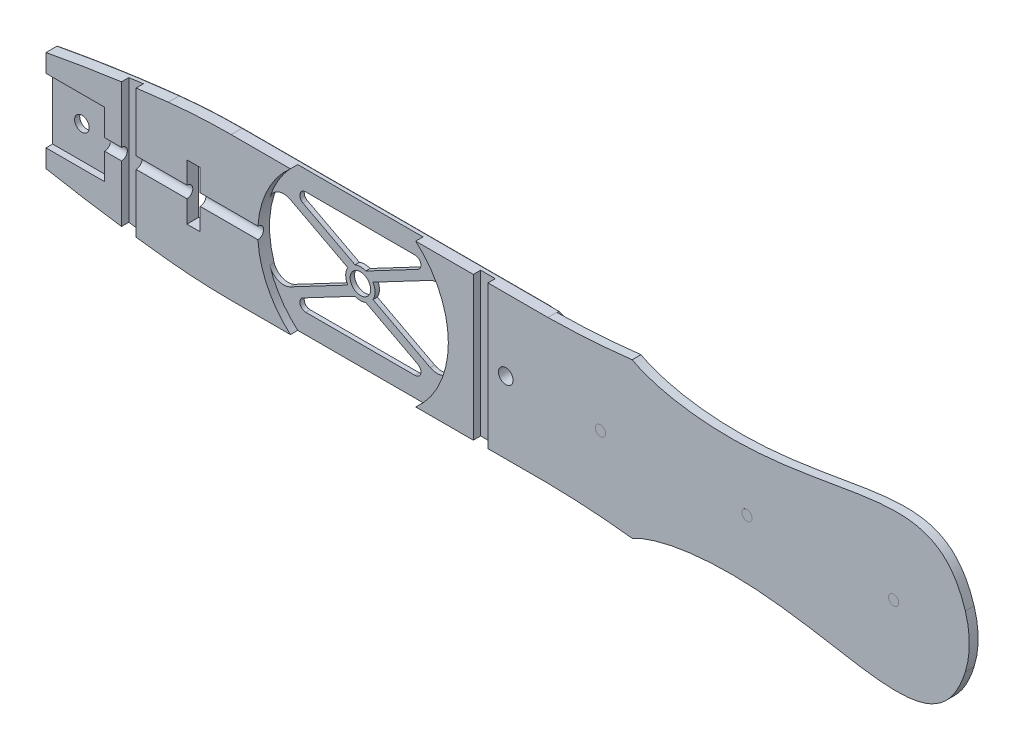
from build123d import *
from build123d.topology import SkipClean

# Parameters (mm, degrees)
BOSS_EXTRUDE1_DEPTH      = 8
FILLET2_R                = 2
SKETCH3_R                = 2.5
CUT_EXTRUDE1_DEPTH       = 8
SKETCH4_R                = 3.5
CUT_EXTRUDE2_DEPTH       = 8
CUT_EXTRUDE3_DEPTH       = 2.5
CUT_EXTRUDE3_DEPTH_BACK  = 2.5
SKETCH5_R                = 32.5
SKETCH6_W                = 4.5
SKETCH6_H                = 19
CUT_EXTRUDE4_DEPTH       = 10
SKETCH7_W                = 5
SKETCH7_H                = 5
CUT_EXTRUDE5_DEPTH       = 51
FILLET3_START            = -1
FILLET3_DEPTH            = 10
FILLET4_START            = -1
FILLET4_DEPTH            = 10
SKETCH9_W                = 5
SKETCH9_H                = 5
CUT_EXTRUDE6_DEPTH       = 51
CUT_EXTRUDE7_DEPTH       = 64
CUT_EXTRUDE7_DEPTH_BACK  = 25
SKETCH10_R               = 2
FILLET5_DEPTH            = 1.5
FILLET5_START            = 6.5
FILLET5_2_DEPTH          = 1.5
CUT_EXTRUDE8_START       = -4
CUT_EXTRUDE8_DEPTH       = 4
FILLET6_R                = 0.3
SKETCH13_W               = 4.5
SKETCH13_H               = 22
CUT_EXTRUDE9_DEPTH       = 20
SKETCH14_R               = 2.5
CUT_EXTRUDE10_DEPTH      = 10
BOSS_EXTRUDE2_DEPTH      = 3
FILLET7_R                = 5
BOSS_EXTRUDE3_DEPTH      = 3
FILLET8_R                = 30
SKETCH17_R               = 1.75
CUT_EXTRUDE11_DEPTH      = 3
BOSS_EXTRUDE4_DEPTH      = 10
BOSS_EXTRUDE4_DEPTH_BACK = 3
SKETCH18_R               = 1.75
BOSS_EXTRUDE5_DEPTH      = 10
BOSS_EXTRUDE5_DEPTH_BACK = 3
SKETCH19_R               = 1.75
BOSS_EXTRUDE6_DEPTH      = 9.5
BOSS_EXTRUDE6_DEPTH_BACK = 3
SKETCH20_R               = 1.75


with BuildPart() as part:
    # Sketch2 → Boss-Extrude1 (new body)
    with BuildSketch(Plane.XY):
        with BuildLine():
            Line((-102.95960155, 17.159933592), (-102.95960155, -17.159933592))
            add(Edge.make_bspline(
                [(-102.95960155, -17.159933592), (-76.189992309, -22.210205625), (-49.286425804, -24.488951052)],
                knots=[0, 0, 0, 0.320704871, 0.320704871, 0.320704871], degree=2))
            Line((-49.286425804, -24.488951052), (65.285160882, -24.488951052))
            Line((65.285160882, -24.488951052), (65.285160882, 24.488951052))
            Line((65.285160882, 24.488951052), (-49.286425804, 24.488951052))
            add(Edge.make_bspline(
                [(-102.95960155, 17.159933592), (-76.189992309, 22.210205625), (-49.286425804, 24.488951052)],
                knots=[0, 0, 0, 0.320704871, 0.320704871, 0.320704871], degree=2))
        make_face()
        with BuildLine():
            Line((-24.971677166, 17.771677006), (28.500163837, 17.771677006))
            Line((28.500163837, 17.771677006), (3.599814154, 4.650879462))
            ThreePointArc((3.599814154, 4.650879462), (1.764243335, 5), (-0.071327484, 4.650879462))
            Line((-0.071327484, 4.650879462), (-24.971677166, 17.771677006))
        make_face(mode=Mode.SUBTRACT)
        with BuildLine():
            Line((3.599814154, -4.650879462), (28.500163837, -17.771677006))
            Line((28.500163837, -17.771677006), (-24.971677166, -17.771677006))
            Line((-24.971677166, -17.771677006), (-0.071327484, -4.650879462))
            ThreePointArc((-0.071327484, -4.650879462), (1.764243335, -5), (3.599814154, -4.650879462))
        make_face(mode=Mode.SUBTRACT)
        with BuildLine():
            Line((-2.525196045, 2.569184657), (-26.859859934, 15.391904107))
            ThreePointArc((-26.859859934, 15.391904107), (-30.735756665, 0), (-26.859859934, -15.391904107))
            Line((-26.859859934, -15.391904107), (-2.525196045, -2.569184657))
            ThreePointArc((-2.525196045, -2.569184657), (-3.235756665, 0), (-2.525196045, 2.569184657))
        make_face(mode=Mode.SUBTRACT)
        with BuildLine():
            Line((6.053682716, -2.569184657), (30.388346604, -15.391904107))
            ThreePointArc((30.388346604, -15.391904107), (34.264243335, 0), (30.388346604, 15.391904107))
            Line((30.388346604, 15.391904107), (6.053682716, 2.569184657))
            ThreePointArc((6.053682716, 2.569184657), (6.764243335, 0), (6.053682716, -2.569184657))
        make_face(mode=Mode.SUBTRACT)
    extrude(amount=BOSS_EXTRUDE1_DEPTH)

    # Fillet2
    fillet2_edges = [part.edges().sort_by_distance(p)[0] for p in [
        (-24.971677166, 17.771677006, 4),
        (28.500163837, 17.771677006, 4),
        (-24.971677166, -17.771677006, 4),
        (28.500163837, -17.771677006, 4),
    ]]
    fillet(fillet2_edges, radius=FILLET2_R)

    # Sketch3 → Cut-Extrude1 (cut)
    with BuildSketch(Plane.XY.offset(8)):
        with Locations((53.859940094, 0)):
            Circle(SKETCH3_R)
    extrude(amount=-CUT_EXTRUDE1_DEPTH, mode=Mode.SUBTRACT)

    # Sketch4 → Cut-Extrude2 (cut)
    with BuildSketch(Plane.XY.offset(8)):
        with Locations((1.764243335, 0)):
            Circle(SKETCH4_R)
    extrude(amount=-CUT_EXTRUDE2_DEPTH, mode=Mode.SUBTRACT)

    # Sketch5 → Cut-Extrude3 (cut, two sides: drawn at the far end of the back side and taken through both)
    with SkipClean():  # the faces are left unmerged after this step: merging them gives an invalid solid
        with BuildSketch(Plane.XY.offset(4).offset(-CUT_EXTRUDE3_DEPTH_BACK)):
            with Locations((1.764243335, 0)):
                Circle(SKETCH5_R)
        extrude(amount=CUT_EXTRUDE3_DEPTH + CUT_EXTRUDE3_DEPTH_BACK, mode=Mode.SUBTRACT)

    # Sketch6 → Cut-Extrude4 (cut)
    with SkipClean():  # the faces are left unmerged after this step: merging them gives an invalid solid
        with BuildSketch(Plane.XY.offset(8)):
            with Locations((-52.644112073, 0)):
                Rectangle(SKETCH6_W, SKETCH6_H)
        extrude(amount=-CUT_EXTRUDE4_DEPTH, mode=Mode.SUBTRACT)

    # Sketch7 → Cut-Extrude5 (cut)
    with SkipClean():  # the faces are left unmerged after this step: merging them gives an invalid solid
        with BuildSketch(Plane(origin=(0, 24.488951052, 0), x_dir=(1, 0, 0), z_dir=(0, 1, 0))):
            with Locations((45.285160882, -4)):
                Rectangle(SKETCH7_W, SKETCH7_H)
        extrude(amount=-CUT_EXTRUDE5_DEPTH, mode=Mode.SUBTRACT)

    # Fillet3: read off the stored shape, not the designer's step
    # Fillet3 outline → Fillet3 (cut)
    with SkipClean():  # the faces are left unmerged after this step: merging them gives an invalid solid
        with BuildSketch(Plane.XY.offset(FILLET3_START)):
            with BuildLine():
                add(Edge.make_bspline(
                    [(-49.286425804, 24.488951052), (-55.269151656, 23.982211205), (-61.245253134, 23.338415518)],
                    knots=[0, 0, 0, 0.071317285, 0.071317285, 0.071317285], degree=2))
                ThreePointArc((-61.245253134, 23.338415518), (-50.549825889, 24.201110037), (-39.823523948, 24.488951052))
                Line((-39.823523948, 24.488951052), (-49.286425804, 24.488951052))
            make_face()
        extrude(amount=FILLET3_DEPTH, mode=Mode.SUBTRACT)

    # Fillet4: read off the stored shape, not the designer's step
    # Fillet4 outline → Fillet4 (cut)
    with SkipClean():  # the faces are left unmerged after this step: merging them gives an invalid solid
        with BuildSketch(Plane.XY.offset(FILLET4_START)):
            with BuildLine():
                Line((-49.286425804, -24.488951052), (-39.823523948, -24.488951052))
                ThreePointArc((-39.823523948, -24.488951052), (-50.549825889, -24.201110037), (-61.245253134, -23.338415518))
                add(Edge.make_bspline(
                    [(-61.245253134, -23.338415518), (-55.269151656, -23.982211205), (-49.286425804, -24.488951052)],
                    knots=[0.249387586, 0.249387586, 0.249387586, 0.320704871, 0.320704871, 0.320704871], degree=2))
            make_face()
        extrude(amount=FILLET4_DEPTH, mode=Mode.SUBTRACT)

    # Sketch9 → Cut-Extrude6 (cut)
    with SkipClean():  # the faces are left unmerged after this step: merging them gives an invalid solid
        with BuildSketch(Plane(origin=(0, 24.488951052, 0), x_dir=(1, 0, 0), z_dir=(0, 1, 0))):
            with Locations((-74.714839118, -4)):
                Rectangle(SKETCH9_W, SKETCH9_H)
        extrude(amount=-CUT_EXTRUDE6_DEPTH, mode=Mode.SUBTRACT)

    # Sketch10 → Cut-Extrude7 (cut, two sides: drawn at the far end of the back side and taken through both)
    with SkipClean():  # the faces are left unmerged after this step: merging them gives an invalid solid
        with BuildSketch(Plane.ZY.offset(50.394112073).offset(-CUT_EXTRUDE7_DEPTH_BACK)):
            with Locations(Location((4, 0, 0), (0, 0, 180))):
                Circle(SKETCH10_R)
        extrude(amount=CUT_EXTRUDE7_DEPTH + CUT_EXTRUDE7_DEPTH_BACK, mode=Mode.SUBTRACT)

    # Fillet5: read off the stored shape, not the designer's step
    # Fillet5 outline → Fillet5 (add)
    with SkipClean():  # the faces are left unmerged after this step: merging them gives an invalid solid
        with BuildSketch(Plane.XY):
            with BuildLine():
                Line((30.388346604, 15.391904107), (25.603831674, 12.87078884))
                ThreePointArc((25.603831674, 12.87078884), (29.820861326, 13.077915151), (32.692963641, 9.983198898))
                ThreePointArc((32.692963641, 9.983198898), (31.663210239, 12.739771507), (30.388346604, 15.391904107))
            make_face()
            with BuildLine():
                ThreePointArc((30.388346604, -15.391904107), (31.663210239, -12.739771507), (32.692963641, -9.983198898))
                ThreePointArc((32.692963641, -9.983198898), (29.820861326, -13.077915151), (25.603831674, -12.87078884))
                Line((25.603831674, -12.87078884), (30.388346604, -15.391904107))
            make_face()
            with BuildLine():
                Line((-26.859859934, -15.391904107), (-22.075345003, -12.87078884))
                ThreePointArc((-22.075345003, -12.87078884), (-26.292374655, -13.077915151), (-29.164476971, -9.983198898))
                ThreePointArc((-29.164476971, -9.983198898), (-28.134723569, -12.739771507), (-26.859859934, -15.391904107))
            make_face()
            with BuildLine():
                ThreePointArc((-26.859859934, 15.391904107), (-28.134723569, 12.739771507), (-29.164476971, 9.983198898))
                ThreePointArc((-29.164476971, 9.983198898), (-26.292374655, 13.077915151), (-22.075345003, 12.87078884))
                Line((-22.075345003, 12.87078884), (-26.859859934, 15.391904107))
            make_face()
        extrude(amount=FILLET5_DEPTH)

    # Fillet5 2 outline → Fillet5 2 (add)
    with SkipClean():  # the faces are left unmerged after this step: merging them gives an invalid solid
        with BuildSketch(Plane.XY.offset(FILLET5_START)):
            with BuildLine():
                Line((30.388346604, 15.391904107), (25.603831674, 12.87078884))
                ThreePointArc((25.603831674, 12.87078884), (29.820861326, 13.077915151), (32.692963641, 9.983198898))
                ThreePointArc((32.692963641, 9.983198898), (31.663210239, 12.739771507), (30.388346604, 15.391904107))
            make_face()
            with BuildLine():
                ThreePointArc((30.388346604, -15.391904107), (31.663210239, -12.739771507), (32.692963641, -9.983198898))
                ThreePointArc((32.692963641, -9.983198898), (29.820861326, -13.077915151), (25.603831674, -12.87078884))
                Line((25.603831674, -12.87078884), (30.388346604, -15.391904107))
            make_face()
            with BuildLine():
                Line((-26.859859934, -15.391904107), (-22.075345003, -12.87078884))
                ThreePointArc((-22.075345003, -12.87078884), (-26.292374655, -13.077915151), (-29.164476971, -9.983198898))
                ThreePointArc((-29.164476971, -9.983198898), (-28.134723569, -12.739771507), (-26.859859934, -15.391904107))
            make_face()
            with BuildLine():
                ThreePointArc((-26.859859934, 15.391904107), (-28.134723569, 12.739771507), (-29.164476971, 9.983198898))
                ThreePointArc((-29.164476971, 9.983198898), (-26.292374655, 13.077915151), (-22.075345003, 12.87078884))
                Line((-22.075345003, 12.87078884), (-26.859859934, 15.391904107))
            make_face()
        extrude(amount=FILLET5_2_DEPTH)


with BuildPart() as body_2:
    # Split1: read off the stored shape, not the designer's step
    # Split1: the piece on the far side of the plane
    add(part.part)
    split(bisect_by=Plane.XY.offset(4), keep=Keep.BOTTOM)

    # Fillet6
    fillet6_edges = [body_2.edges().sort_by_distance(p)[0] for p in [
        (-82.163571081, 20.662100298, 0),
        (-82.163571081, -20.662100298, 0),
        (12.730818467, -24.488951052, 0),
        (12.730818467, 24.488951052, 0),
        (-50.549825889, 24.201110037, 0),
        (-50.549825889, -24.201110037, 0),
    ]]
    fillet(fillet6_edges, radius=FILLET6_R)

    # Sketch13 → Cut-Extrude9 (cut)
    with SkipClean():  # the faces are left unmerged after this step: merging them gives an invalid solid
        with BuildSketch(Plane.ZY.offset(102.95960155)):
            with Locations((4, 0)):
                Rectangle(SKETCH13_W, SKETCH13_H)
        extrude(amount=-CUT_EXTRUDE9_DEPTH, mode=Mode.SUBTRACT)

    # Sketch14 → Cut-Extrude10 (cut)
    with SkipClean():  # the faces are left unmerged after this step: merging them gives an invalid solid
        with BuildSketch(Plane(origin=(0, 0, 0), x_dir=(-1, 0, 0), z_dir=(0, 0, -1))):
            with Locations((92.95960155, 0)):
                Circle(SKETCH14_R)
        extrude(amount=-CUT_EXTRUDE10_DEPTH, mode=Mode.SUBTRACT)

    # Sketch15 → Boss-Extrude2 (add)
    with SkipClean():  # the faces are left unmerged after this step: merging them gives an invalid solid
        with BuildSketch(Plane(origin=(65.285160882, 0, 0), x_dir=(0, 0, -1), z_dir=(1, 0, 0))):
            with BuildLine():
                Line((-4, -24.488951052), (-0.3, -24.488951052))
                ThreePointArc((-0.3, -24.488951052), (8.494138822, 0), (-0.3, 24.488951052))
                Line((-0.3, 24.488951052), (-4, 24.488951052))
                Line((-4, 24.488951052), (-4, -24.488951052))
            make_face()
        extrude(amount=BOSS_EXTRUDE2_DEPTH)

    # Fillet7
    # the kernel refuses this fillet: 5 mm, written as the material it adds along each edge
    with BuildSketch(Plane(origin=(65.285160882, -36.620504215, 0), x_dir=(-1, 0, 0), z_dir=(0, 1, 0))) as fillet7_piece_1_section:
        with BuildLine():
            CenterArc((FILLET7_R, -FILLET7_R), FILLET7_R, 90, 90)
            Line((0, -FILLET7_R), (0, 0))
            Line((0, 0), (FILLET7_R, 0))
        make_face()
    fillet7_piece_1 = extrude(amount=73.241008431, mode=Mode.PRIVATE)
    fillet7_piece_1 = fillet7_piece_1 & Plane(origin=(65.285160882, 0, 30), x_dir=(0, -0.6361735007294052, -0.7715460303635122), z_dir=(-1, 0, 0)) * Cylinder(38.494138822, 167, mode=Mode.PRIVATE)
    add(fillet7_piece_1)

    # Sketch16 → Boss-Extrude3 (add)
    with SkipClean():  # the faces are left unmerged after this step: merging them gives an invalid solid
        with BuildSketch(Plane.XY.offset(4)):
            with BuildLine():
                Line((68.228880523, -24.495656608), (68.228880523, 24.495656608))
                add(Edge.make_bspline(
                    [(68.228880523, 24.495656608), (82.646834447, 24.684511666), (96.969037286, 26.377260246)],
                    knots=[0, 0, 0, 1, 1, 1], degree=2))
                add(Edge.make_bspline(
                    [(96.969037286, 26.377260246), (104.002832296, 22.524590477), (164.572793012, 11.938021257), (205.32834893, 45.724469719), (212.637340347, 0)],
                    knots=[0, 0, 0, 0, 0.177348709, 1, 1, 1, 1], degree=3))
                add(Edge.make_bspline(
                    [(96.969037286, -26.377260246), (104.002832296, -22.524590477), (164.572793012, -11.938021257), (205.32834893, -45.724469719), (212.637340347, 0)],
                    knots=[0, 0, 0, 0, 0.177348709, 1, 1, 1, 1], degree=3))
                add(Edge.make_bspline(
                    [(68.228880523, -24.495656608), (82.646834447, -24.684511666), (96.969037286, -26.377260246)],
                    knots=[0, 0, 0, 1, 1, 1], degree=2))
            make_face()
        extrude(amount=-BOSS_EXTRUDE3_DEPTH)

    # Fillet8
    fillet8_edges = [body_2.edges().sort_by_distance(p)[0] for p in [
        (212.637340347, 0, 2.5),
    ]]
    fillet(fillet8_edges, radius=FILLET8_R)

    # Sketch17 → Cut-Extrude11 (cut)
    with BuildSketch(Plane(origin=(0, 0, 1), x_dir=(-1, 0, 0), z_dir=(0, 0, -1))):
        with Locations((-86.130146623, 0)):
            Circle(SKETCH17_R)
        with Locations((-136.130146623, 0)):
            Circle(SKETCH17_R)
        with Locations((-186.130146623, 0)):
            Circle(SKETCH17_R)
    extrude(amount=-CUT_EXTRUDE11_DEPTH, mode=Mode.SUBTRACT)


with BuildPart() as part_1:
    add(part.part)

    # Split1
    split(bisect_by=Plane.XY.offset(4), keep=Keep.TOP)

    # Sketch12 → Cut-Extrude8 (cut)
    with BuildSketch(Plane.XY.offset(8).offset(CUT_EXTRUDE8_START)):
        with BuildLine():
            Line((-39.823523948, -24.488951052), (65.285160882, -24.488951052))
            Line((65.285160882, -24.488951052), (65.285160882, 24.488951052))
            Line((65.285160882, 24.488951052), (-39.823523948, 24.488951052))
            ThreePointArc((-39.823523948, 24.488951052), (-50.549825889, 24.201110037), (-61.245253134, 23.338415518))
            add(Edge.make_bspline(
                [(-61.245253134, 23.338415518), (-82.142929204, 21.087142885), (-102.959601581, 17.159933586)],
                knots=[0, 0, 0, 1, 1, 1], degree=2))
            Line((-102.959601581, 17.159933586), (-102.959601388, -17.159933622))
            add(Edge.make_bspline(
                [(-102.959601388, -17.159933622), (-82.142929109, -21.087142896), (-61.245253139, -23.338415518)],
                knots=[0, 0, 0, 1, 1, 1], degree=2))
            ThreePointArc((-61.245253139, -23.338415518), (-50.549825891, -24.201110037), (-39.823523948, -24.488951052))
        make_face()
    extrude(amount=CUT_EXTRUDE8_DEPTH, mode=Mode.SUBTRACT)


with BuildPart() as body_2_2:
    # Sketch18 → Boss-Extrude4 (new, two sides: drawn at the far end of the back side and taken through both)
    with BuildSketch(Plane(origin=(0, 0, 1), x_dir=(-1, 0, 0), z_dir=(0, 0, -1)).offset(-BOSS_EXTRUDE4_DEPTH_BACK)):
        with Locations((-86.130146623, 0)):
            Circle(SKETCH18_R)
    extrude(amount=BOSS_EXTRUDE4_DEPTH + BOSS_EXTRUDE4_DEPTH_BACK)


with BuildPart() as body_3:
    # Sketch19 → Boss-Extrude5 (new, two sides: drawn at the far end of the back side and taken through both)
    with BuildSketch(Plane(origin=(0, 0, 1), x_dir=(-1, 0, 0), z_dir=(0, 0, -1)).offset(-BOSS_EXTRUDE5_DEPTH_BACK)):
        with Locations((-186.130146623, 0)):
            Circle(SKETCH19_R)
    extrude(amount=BOSS_EXTRUDE5_DEPTH + BOSS_EXTRUDE5_DEPTH_BACK)


with BuildPart() as body_4:
    # Sketch20 → Boss-Extrude6 (new, two sides: drawn at the far end of the back side and taken through both)
    with BuildSketch(Plane(origin=(0, 0, 1), x_dir=(-1, 0, 0), z_dir=(0, 0, -1)).offset(-BOSS_EXTRUDE6_DEPTH_BACK)):
        with Locations((-136.130146623, 0)):
            Circle(SKETCH20_R)
    extrude(amount=BOSS_EXTRUDE6_DEPTH + BOSS_EXTRUDE6_DEPTH_BACK)


solid = Compound([body_2.part, body_2_2.part, body_3.part, body_4.part])
